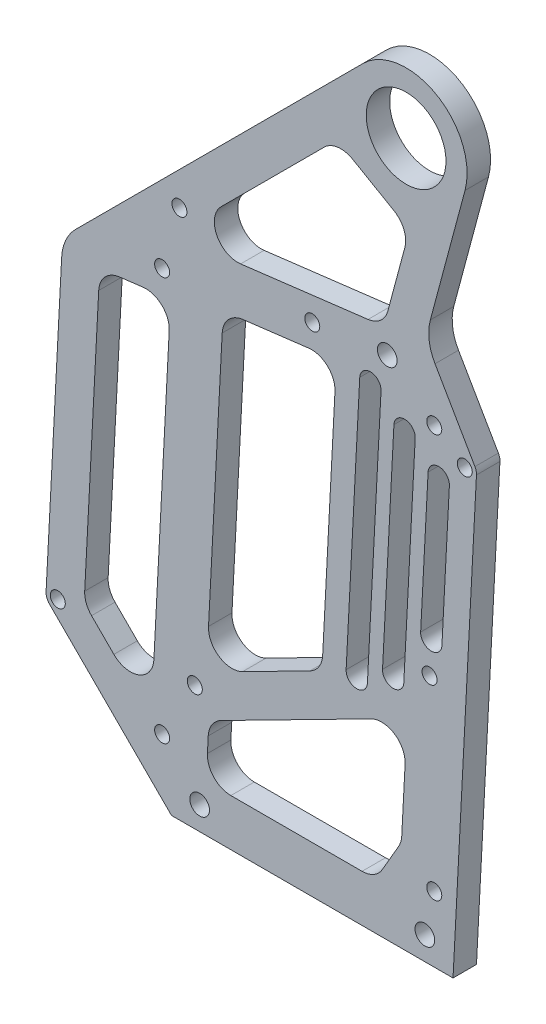
from build123d import *

# Parameters (mm, degrees)
SKETCH1_W           = 80
SKETCH1_H           = 180
SKETCH1_R           = 8.5
BOSS_EXTRUDE1_DEPTH = 5
SKETCH2_R           = 5.5
CUT_EXTRUDE1_DEPTH  = 30
SKETCH3_R           = 1.6
SKETCH3_R_2         = 2.5
CUT_EXTRUDE2_DEPTH  = 5
CUT_EXTRUDE3_DEPTH  = 10
BOSS_EXTRUDE2_DEPTH = 5
FILLET1_R           = 2
FILLET2_R           = 5
SKETCH6_R           = 2.1
CUT_EXTRUDE4_DEPTH  = 5
SKETCH7_W           = 58.3648838
SKETCH7_H           = 19.178580611
BOSS_EXTRUDE3_DEPTH = 5
SKETCH8_R           = 2.1
CUT_EXTRUDE5_DEPTH  = 5
SKETCH9_R           = 1.6
CUT_EXTRUDE6_DEPTH  = 5
BOSS_EXTRUDE4_START = -5
SKETCH10_R          = 5.5
SKETCH10_R_2        = 1.6
BOSS_EXTRUDE4_DEPTH = 5
FILLET3_R           = 10
FILLET4_R           = 2.5
SKETCH11_R          = 1.6
CUT_EXTRUDE7_DEPTH  = 5
FILLET5_R           = 5


with BuildPart() as part:
    # Sketch1 → Boss-Extrude1 (new body)
    with BuildSketch(Plane.XY):
        with Locations((10, 166)):
            Rectangle(SKETCH1_W, SKETCH1_H)
        with Locations((20, 226)):
            Circle(SKETCH1_R, mode=Mode.SUBTRACT)
    extrude(amount=BOSS_EXTRUDE1_DEPTH)

    # Sketch2 → Cut-Extrude1 (cut)
    with BuildSketch(Plane.XY.offset(5)):
        with Locations((20, 151)):
            Circle(SKETCH2_R)
    extrude(amount=-CUT_EXTRUDE1_DEPTH, mode=Mode.SUBTRACT)

    # Sketch3 → Cut-Extrude2 (cut)
    with BuildSketch(Plane.XY.offset(5)):
        with Locations((0, 182)):
            Circle(SKETCH3_R)
        with Locations((25, 129.301270189)):
            Circle(SKETCH3_R)
        with Locations((-25.032859693, 102.533479235)):
            Circle(SKETCH3_R)
        with Locations((-15, 81)):
            Circle(SKETCH3_R_2)
        with Locations((15, 81)):
            Circle(SKETCH3_R_2)
        with Locations((24, 91)):
            Circle(SKETCH3_R_2)
        with Locations((-24, 91)):
            Circle(SKETCH3_R_2)
    extrude(amount=-CUT_EXTRUDE2_DEPTH, mode=Mode.SUBTRACT)

    # Sketch4 → Cut-Extrude3 (cut)
    with BuildSketch(Plane.XY.offset(5)):
        with BuildLine():
            Line((-30, 194.384776311), (10.807611845, 235.192388155))
            ThreePointArc((10.807611845, 235.192388155), (24.974884621, 238.010433923), (33, 226))
            ThreePointArc((33, 226), (32.888783198, 224.303159501), (32.557035742, 222.635352414))
            Line((32.557035742, 222.635352414), (22.786943589, 186.172872106))
            Line((22.786943589, 186.172872106), (30, 173.679491924))
            Line((30, 173.679491924), (30, 76))
            Line((30, 76), (50, 76))
            Line((50, 76), (50, 256))
            Line((50, 256), (-30, 256))
            Line((-30, 256), (-30, 194.384776311))
        make_face()
    extrude(amount=-CUT_EXTRUDE3_DEPTH, mode=Mode.SUBTRACT)

    # Sketch5 → Boss-Extrude2 (add)
    with BuildSketch(Plane.XY.offset(5)):
        with BuildLine():
            Line((-30, 169.384776311), (-30, 194.384776311))
            Line((-30, 194.384776311), (-46.535533906, 177.849242405))
            ThreePointArc((-46.535533906, 177.849242405), (-47.619397663, 176.227125661), (-48, 174.313708499))
            Line((-48, 174.313708499), (-48, 96.071067812))
            ThreePointArc((-48, 96.071067812), (-47.619397663, 94.15765065), (-46.535533906, 92.535533906))
            Line((-46.535533906, 92.535533906), (-30, 76))
            Line((-30, 76), (-30, 101))
            ThreePointArc((-30, 101), (-35, 96), (-40, 101))
            Line((-40, 101), (-40, 131.707106781))
            Line((-40, 131.707106781), (-30, 121.707106781))
            Line((-30, 121.707106781), (-30, 138.67766953))
            Line((-30, 138.67766953), (-40, 148.67766953))
            Line((-40, 148.67766953), (-40, 169.384776311))
            ThreePointArc((-40, 169.384776311), (-35, 174.384776311), (-30, 169.384776311))
        make_face()
    extrude(amount=-BOSS_EXTRUDE2_DEPTH)

    # Fillet1
    fillet1_edges = [part.edges().sort_by_distance(p)[0] for p in [
        (-40, 131.707106781, 2.5),
        (-40, 148.67766953, 2.5),
        (-30, 121.707106781, 2.5),
        (-30, 138.67766953, 2.5),
    ]]
    fillet(fillet1_edges, radius=FILLET1_R)

    # Fillet2
    fillet2_edges = [part.edges().sort_by_distance(p)[0] for p in [
        (30, 173.679491924, 2.5),
        (22.786943589, 186.172872106, 2.5),
    ]]
    fillet(fillet2_edges, radius=FILLET2_R)

    # Sketch6 → Cut-Extrude4 (cut)
    with BuildSketch(Plane.XY.offset(5)):
        with Locations((15.982125076, 183.959163508)):
            Circle(SKETCH6_R)
    extrude(amount=-CUT_EXTRUDE4_DEPTH, mode=Mode.SUBTRACT)

    # Sketch7 → Boss-Extrude3 (add)
    with BuildSketch(Plane(origin=(0, 0, 0), x_dir=(-1, 0, 0), z_dir=(0, 0, -1))):
        with Locations((-0.8175581, 85.589290306)):
            Rectangle(SKETCH7_W, SKETCH7_H)
    extrude(amount=-BOSS_EXTRUDE3_DEPTH)

    # Sketch8 → Cut-Extrude5 (cut)
    with BuildSketch(Plane(origin=(0, 0, 0), x_dir=(-1, 0, 0), z_dir=(0, 0, -1))):
        with Locations((24, 81)):
            Circle(SKETCH8_R)
        with Locations((-24, 81)):
            Circle(SKETCH8_R)
    extrude(amount=-CUT_EXTRUDE5_DEPTH, mode=Mode.SUBTRACT)

    # Sketch9 → Cut-Extrude6 (cut)
    with BuildSketch(Plane(origin=(0, 0, 0), x_dir=(-1, 0, 0), z_dir=(0, 0, -1))):
        with Locations((-26, 176)):
            Circle(SKETCH9_R)
        with Locations((32, 176)):
            Circle(SKETCH9_R)
        with Locations((-26, 90)):
            Circle(SKETCH9_R)
        with Locations((32, 90)):
            Circle(SKETCH9_R)
    extrude(amount=-CUT_EXTRUDE6_DEPTH, mode=Mode.SUBTRACT)

    # Sketch10 → Boss-Extrude4 (add)
    # profile 1 of 4: a face of its own
    with BuildSketch(Plane(origin=(0, 0, 0), x_dir=(-1, 0, 0), z_dir=(0, 0, -1)).offset(BOSS_EXTRUDE4_START)):
        with Locations((-20, 151)):
            Circle(SKETCH10_R)
    # profile 2 of 4: a face of its own
    with BuildSketch(Plane(origin=(0, 0, 0), x_dir=(-1, 0, 0), z_dir=(0, 0, -1)).offset(BOSS_EXTRUDE4_START)):
        with BuildLine():
            Line((-24.0903204, 191.037140585), (-35.035330378, 172.079827214))
            Line((-35.035330378, 172.079827214), (-30, 76))
            Line((-30, 76), (-30, 172.339745962))
            ThreePointArc((-30, 172.339745962), (-29.829629131, 173.633841188), (-29.330127019, 174.839745962))
            Line((-29.330127019, 174.839745962), (-22.786943589, 186.172872106))
            Line((-22.786943589, 186.172872106), (-24.0903204, 191.037140585))
        make_face()
        with Locations((-32.5, 171.471148243)):
            Circle(SKETCH10_R_2, mode=Mode.SUBTRACT)
    # profile 3 of 4: a face of its own
    with BuildSketch(Plane(origin=(0, 0, 0), x_dir=(-1, 0, 0), z_dir=(0, 0, -1)).offset(BOSS_EXTRUDE4_START)):
        with BuildLine():
            Line((30, 169.384776311), (30, 101))
            ThreePointArc((30, 101), (35, 96), (40, 101))
            Line((40, 101), (40, 169.384776311))
            ThreePointArc((40, 169.384776311), (35, 174.384776311), (30, 169.384776311))
        make_face()
    # profile 4 of 4: a face of its own
    with BuildSketch(Plane(origin=(0, 0, 0), x_dir=(-1, 0, 0), z_dir=(0, 0, -1)).offset(BOSS_EXTRUDE4_START)):
        Polygon((46.535533906, 92.535533906), (56.788582233, 102.788582233), (53.20431577, 171.180460541), (46.535533906, 177.849242405), align=None)
        with Locations((54.233754724, 103.76928863)):
            Circle(SKETCH10_R_2, mode=Mode.SUBTRACT)
    extrude(amount=BOSS_EXTRUDE4_DEPTH)

    # Fillet3
    fillet3_edges = [part.edges().sort_by_distance(p)[0] for p in [
        (-53.20431577, 171.180460541, 2.5),
        (24.0903204, 191.037140585, 2.5),
    ]]
    fillet(fillet3_edges, radius=FILLET3_R)

    # Fillet4
    fillet4_edges = [part.edges().sort_by_distance(p)[0] for p in [
        (35.035330378, 172.079827214, 2.5),
        (-56.788582233, 102.788582233, 2.5),
    ]]
    fillet(fillet4_edges, radius=FILLET4_R)

    # Sketch11 → Cut-Extrude7 (cut)
    with BuildSketch(Plane(origin=(0, 0, 0), x_dir=(-1, 0, 0), z_dir=(0, 0, -1))):
        with Locations((28.313708499, 189)):
            Circle(SKETCH11_R)
        Polygon((-20.731588667, 209.411809549), (-15.236868274, 188.905233871), (29.670829152, 183.40023866), (-5.268411333, 218.339479145), align=None)
        with BuildLine():
            Line((-24.688485035, 166.730832893), (-23.09946265, 136.410479553))
            ThreePointArc((-23.09946265, 136.410479553), (-25.247549073, 134.024787889), (-27.633240738, 136.172874312))
            Line((-27.633240738, 136.172874312), (-29.222263123, 166.493227651))
            ThreePointArc((-29.222263123, 166.493227651), (-27.0741767, 168.878919316), (-24.688485035, 166.730832893))
        make_face()
        with BuildLine():
            Line((-17.405399982, 171.830503949), (-14.975614279, 125.467430828))
            ThreePointArc((-14.975614279, 125.467430828), (-17.123700702, 123.081739164), (-19.509392367, 125.229825587))
            Line((-19.509392367, 125.229825587), (-21.939178069, 171.592898708))
            ThreePointArc((-21.939178069, 171.592898708), (-19.791091646, 173.978590372), (-17.405399982, 171.830503949))
        make_face()
        with BuildLine():
            Line((-10.122314928, 176.930175005), (-7.218117601, 121.514788847))
            ThreePointArc((-7.218117601, 121.514788847), (-9.366204025, 119.129097182), (-11.751895689, 121.277183606))
            Line((-11.751895689, 121.277183606), (-14.656093016, 176.692569764))
            ThreePointArc((-14.656093016, 176.692569764), (-12.508006593, 179.078261428), (-10.122314928, 176.930175005))
        make_face()
        Polygon((-20.238043689, 119.018648596), (-19.007471072, 95.537924299), (-13.500747911, 86), (22.620402435, 86), (22.018344842, 97.487943236), align=None)
        Polygon((30.172429812, 171.186604665), (45.290137053, 169.333405531), (48.613134203, 105.926842702), (34.340543782, 91.654252281), align=None)
        Polygon((-5.150238223, 177.593912825), (18.97654106, 174.63633958), (22.5637317, 106.188664653), (-2.065730667, 118.738002536), align=None)
    extrude(amount=-CUT_EXTRUDE7_DEPTH, mode=Mode.SUBTRACT)

    # Fillet5
    fillet5_edges = [part.edges().sort_by_distance(p)[0] for p in [
        (-48.613134203, 105.926842702, 2.5),
        (-22.5637317, 106.188664653, 2.5),
        (-34.340543782, 91.654252281, 2.5),
        (13.500747911, 86, 2.5),
        (19.007471072, 95.537924299, 2.5),
        (2.065730667, 118.738002536, 2.5),
        (-22.018344842, 97.487943236, 2.5),
        (-45.290137053, 169.333405531, 2.5),
        (-18.97654106, 174.63633958, 2.5),
        (20.238043689, 119.018648596, 2.5),
        (-30.172429812, 171.186604665, 2.5),
        (5.150238223, 177.593912825, 2.5),
        (-29.670829152, 183.40023866, 2.5),
        (15.236868274, 188.905233871, 2.5),
        (5.268411333, 218.339479145, 2.5),
        (20.731588667, 209.411809549, 2.5),
        (-22.620402435, 86, 2.5),
    ]]
    fillet(fillet5_edges, radius=FILLET5_R)


solid = part.part
